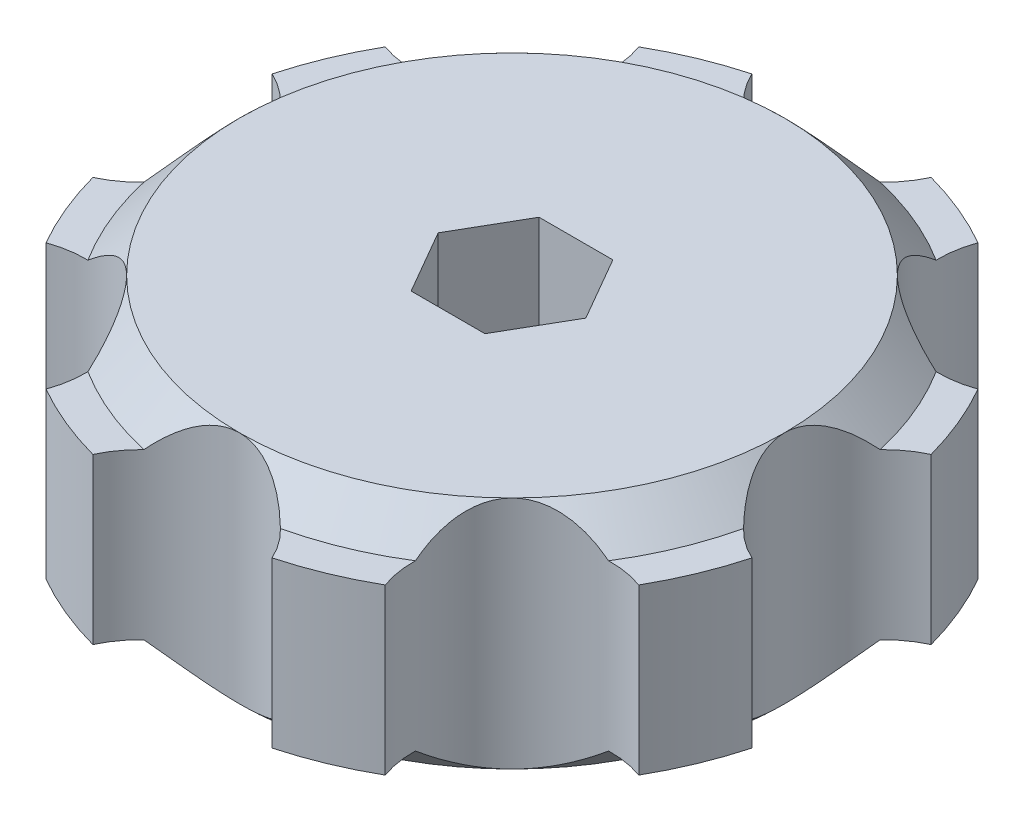
from build123d import *

# Parameters (mm, degrees)
SKETCH1_R           = 15.55551692
BOSS_EXTRUDE1_DEPTH = 9.4
BOSS_EXTRUDE2_START = 9.4
SKETCH1_4_R         = 15.55551692
BOSS_EXTRUDE2_DEPTH = 2
BOSS_EXTRUDE3_START = -2
SKETCH1_5_R         = 15.55551692
BOSS_EXTRUDE3_DEPTH = 2
CHAMFER2_SIZE       = 2
CUT_EXTRUDE1_DEPTH  = 30.783161882


with BuildPart() as part:
    # Sketch1 → Boss-Extrude1 (new body)
    with BuildSketch(Plane(origin=(0, 0, 0), x_dir=(1, 0, 0), z_dir=(0, 1, 0))):
        with BuildLine():
            ThreePointArc((-16.916819633, -9.681614935), (-13.766406033, -9.47966445), (-10.999411499, -10.999411499))
            ThreePointArc((-10.999411499, -10.999411499), (-14.371423694, -5.952838621), (-15.55551692, -3.1e-08))
            ThreePointArc((-15.55551692, -3.1e-08), (-16.437454083, -3.031184056), (-18.807933452, -5.116062305))
            ThreePointArc((-18.807933452, -5.116062305), (-18.007652913, -7.459014063), (-16.916819633, -9.681614935))
        make_face()
        with BuildLine():
            ThreePointArc((-5.116062305, -18.807933452), (-3.031184038, -16.437454071), (1.1e-08, -15.55551692))
            ThreePointArc((1.1e-08, -15.55551692), (-5.952838602, -14.371423702), (-10.999411499, -10.999411499))
            ThreePointArc((-10.999411499, -10.999411499), (-9.47966445, -13.766406033), (-9.681614935, -16.916819633))
            ThreePointArc((-9.681614935, -16.916819633), (-7.459014063, -18.007652913), (-5.116062305, -18.807933452))
        make_face()
        with BuildLine():
            ThreePointArc((1.1e-08, -15.55551692), (3.031184048, -16.437454078), (5.116062305, -18.807933452))
            ThreePointArc((5.116062305, -18.807933452), (7.459014063, -18.007652913), (9.681614935, -16.916819633))
            ThreePointArc((9.681614935, -16.916819633), (9.47966445, -13.766406033), (10.999411499, -10.999411499))
            ThreePointArc((10.999411499, -10.999411499), (5.952838612, -14.371423698), (1.1e-08, -15.55551692))
        make_face()
        Circle(SKETCH1_R)
        with BuildLine():
            ThreePointArc((15.55551692, 0), (14.3714237, -5.952838607), (10.999411499, -10.999411499))
            ThreePointArc((10.999411499, -10.999411499), (13.766406033, -9.47966445), (16.916819633, -9.681614935))
            ThreePointArc((16.916819633, -9.681614935), (18.007652913, -7.459014063), (18.807933452, -5.116062305))
            ThreePointArc((18.807933452, -5.116062305), (16.437454074, -3.031184043), (15.55551692, 0))
        make_face()
        with BuildLine():
            ThreePointArc((10.999411479, 10.999411519), (14.371423695, 5.95283862), (15.55551692, 0))
            ThreePointArc((15.55551692, 0), (16.437454074, 3.031184043), (18.807933452, 5.116062305))
            ThreePointArc((18.807933452, 5.116062305), (18.007652913, 7.459014063), (16.916819633, 9.681614935))
            ThreePointArc((16.916819633, 9.681614935), (13.76640602, 9.479664453), (10.999411479, 10.999411519))
        make_face()
        with BuildLine():
            ThreePointArc((-2e-09, 15.55551692), (5.952838593, 14.371423706), (10.999411479, 10.999411519))
            ThreePointArc((10.999411479, 10.999411519), (9.479664447, 13.766406047), (9.681614935, 16.916819633))
            ThreePointArc((9.681614935, 16.916819633), (7.459014063, 18.007652913), (5.116062305, 18.807933452))
            ThreePointArc((5.116062305, 18.807933452), (3.031184042, 16.437454074), (-2e-09, 15.55551692))
        make_face()
        with BuildLine():
            ThreePointArc((-9.681614935, 16.916819633), (-9.479664448, 13.766406042), (-10.999411487, 10.999411511))
            ThreePointArc((-10.999411487, 10.999411511), (-5.9528386, 14.371423703), (-2e-09, 15.55551692))
            ThreePointArc((-2e-09, 15.55551692), (-3.031184044, 16.437454075), (-5.116062305, 18.807933452))
            ThreePointArc((-5.116062305, 18.807933452), (-7.459014063, 18.007652913), (-9.681614935, 16.916819633))
        make_face()
        with BuildLine():
            ThreePointArc((-18.807933452, 5.116062305), (-16.437454066, 3.03118403), (-15.55551692, -3.1e-08))
            ThreePointArc((-15.55551692, -3.1e-08), (-14.371423703, 5.952838601), (-10.999411487, 10.999411511))
            ThreePointArc((-10.999411487, 10.999411511), (-13.766406025, 9.479664452), (-16.916819633, 9.681614935))
            ThreePointArc((-16.916819633, 9.681614935), (-18.007652913, 7.459014063), (-18.807933452, 5.116062305))
        make_face()
    extrude(amount=BOSS_EXTRUDE1_DEPTH)

    # Sketch1<4> → Boss-Extrude2 (add)
    with BuildSketch(Plane(origin=(0, 0, 0), x_dir=(1, 0, 0), z_dir=(0, 1, 0)).offset(BOSS_EXTRUDE2_START)):
        with Locations(Location((0, 0, 0), (0, 0, 270))):
            Circle(SKETCH1_4_R)
    extrude(amount=BOSS_EXTRUDE2_DEPTH)

    # Sketch1<5> → Boss-Extrude3 (add)
    with BuildSketch(Plane(origin=(0, 0, 0), x_dir=(1, 0, 0), z_dir=(0, 1, 0)).offset(BOSS_EXTRUDE3_START)):
        with Locations(Location((0, 0, 0), (0, 0, 270))):
            Circle(SKETCH1_5_R)
    extrude(amount=BOSS_EXTRUDE3_DEPTH)

    # Chamfer2
    # the kernel refuses this chamfer: 2 mm, written as the material it adds along each edge
    with BuildSketch(Plane(origin=(0, 9.4, 0), x_dir=(-1.0, 0, 2.0490157005346928e-09), z_dir=(-2.0490157005346928e-09, 0, -1.0))) as chamfer2_piece_1_section:
        Polygon((15.55551692, CHAMFER2_SIZE), (15.55551692 + CHAMFER2_SIZE, 0), (15.55551692, 0), align=None)
    chamfer2_piece_1 = revolve(axis=Axis((0, 9.4, 0), (0, 1, 0)), revolution_arc=44.99999982, mode=Mode.PRIVATE)
    chamfer2_piece_1 = chamfer2_piece_1 - Plane(origin=(-21.20551692, 10.103766743, 0), x_dir=(1.0, 0, 5.4411098439037235e-09), z_dir=(0, -1, 0)) * Cylinder(5.65, 71, mode=Mode.PRIVATE)
    chamfer2_piece_1 = chamfer2_piece_1 - Plane(origin=(-14.994564813, 10.103766743, 14.994564813), x_dir=(-0.3402220920568066, 0, -0.9403451111567975), z_dir=(0, -1, 0)) * Cylinder(5.65, 71, mode=Mode.PRIVATE)
    add(chamfer2_piece_1)
    with BuildSketch(Plane(origin=(0, 0, 0), x_dir=(-1.0, 0, 7.725603147000415e-10), z_dir=(-7.725603147000415e-10, 0, -1.0))) as chamfer2_piece_2_section:
        Polygon((15.55551692, -CHAMFER2_SIZE), (15.55551692 + CHAMFER2_SIZE, 0), (15.55551692, 0), align=None)
    chamfer2_piece_2 = revolve(axis=Axis((0, 0, 0), (0, 1, 0)), revolution_arc=44.999999894, mode=Mode.PRIVATE)
    chamfer2_piece_2 = chamfer2_piece_2 - Plane(origin=(-21.20551692, -0.703766743, 0), x_dir=(1.0, 0, 5.4411098439037235e-09), z_dir=(0, -1, 0)) * Cylinder(5.65, 71, mode=Mode.PRIVATE)
    chamfer2_piece_2 = chamfer2_piece_2 - Plane(origin=(-14.994564813, -0.703766743, 14.994564813), x_dir=(-0.3402220920568066, 0, -0.9403451111567975), z_dir=(0, -1, 0)) * Cylinder(5.65, 71, mode=Mode.PRIVATE)
    add(chamfer2_piece_2)
    with BuildSketch(Plane(origin=(0, 0, 0), x_dir=(-0.7071067817031288, 0, -0.7071067806699662), z_dir=(0.7071067806699662, 0, -0.7071067817031288))) as chamfer2_piece_3_section:
        Polygon((15.55551692 + CHAMFER2_SIZE, 0), (15.55551692, -CHAMFER2_SIZE), (15.55551692, 0), align=None)
    chamfer2_piece_3 = revolve(axis=Axis((0, 0, 0), (0, 1, 0)), revolution_arc=45.000000002, mode=Mode.PRIVATE)
    chamfer2_piece_3 = chamfer2_piece_3 - Plane(origin=(-14.994564813, -0.703766886, -14.994564813), x_dir=(0.9403451111567979, 0, -0.34022209205680554), z_dir=(0, -1, 0)) * Cylinder(5.65, 71, mode=Mode.PRIVATE)
    chamfer2_piece_3 = chamfer2_piece_3 - Plane(origin=(-21.20551692, -0.703766886, 0), x_dir=(1.0, 0, 5.4411098439037235e-09), z_dir=(0, -1, 0)) * Cylinder(5.65, 71, mode=Mode.PRIVATE)
    add(chamfer2_piece_3)
    with BuildSketch(Plane(origin=(0, 0, 0), x_dir=(-0.7071067819532592, 0, 0.707106780419836), z_dir=(-0.707106780419836, 0, -0.7071067819532592))) as chamfer2_piece_4_section:
        Polygon((15.55551692, -CHAMFER2_SIZE), (15.55551692 + CHAMFER2_SIZE, 0), (15.55551692, 0), align=None)
    chamfer2_piece_4 = revolve(axis=Axis((0, 0, 0), (0, 1, 0)), revolution_arc=45.000000062, mode=Mode.PRIVATE)
    chamfer2_piece_4 = chamfer2_piece_4 - Plane(origin=(-14.994564813, -0.703766753, 14.994564813), x_dir=(-0.3402220920568066, 0, -0.9403451111567975), z_dir=(0, -1, 0)) * Cylinder(5.65, 71, mode=Mode.PRIVATE)
    chamfer2_piece_4 = chamfer2_piece_4 - Plane(origin=(0, -0.703766753, 21.20551692), x_dir=(-0.9054977531574303, 0, -0.42435105635174936), z_dir=(0, -1, 0)) * Cylinder(5.65, 71, mode=Mode.PRIVATE)
    add(chamfer2_piece_4)
    with BuildSketch(Plane(origin=(0, 0, 0), x_dir=(0, 0, 1), z_dir=(-1, 0, 0))) as chamfer2_piece_5_section:
        Polygon((15.55551692, -CHAMFER2_SIZE), (15.55551692 + CHAMFER2_SIZE, 0), (15.55551692, 0), align=None)
    chamfer2_piece_5 = revolve(axis=Axis((0, 0, 0), (0, 1, 0)), revolution_arc=45, mode=Mode.PRIVATE)
    chamfer2_piece_5 = chamfer2_piece_5 - Plane(origin=(14.994564813, -0.703766753, 14.994564813), x_dir=(-0.9403451111567976, 0, 0.34022209205680604), z_dir=(0, -1, 0)) * Cylinder(5.65, 71, mode=Mode.PRIVATE)
    chamfer2_piece_5 = chamfer2_piece_5 - Plane(origin=(0, -0.703766753, 21.20551692), x_dir=(-0.9054977531574303, 0, -0.42435105635174936), z_dir=(0, -1, 0)) * Cylinder(5.65, 71, mode=Mode.PRIVATE)
    add(chamfer2_piece_5)
    with BuildSketch(Plane(origin=(0, 0, 0), x_dir=(0.7071067811865478, 0, 0.7071067811865472), z_dir=(-0.7071067811865472, 0, 0.7071067811865478))) as chamfer2_piece_6_section:
        Polygon((15.55551692, -CHAMFER2_SIZE), (15.55551692 + CHAMFER2_SIZE, 0), (15.55551692, 0), align=None)
    chamfer2_piece_6 = revolve(axis=Axis((0, 0, 0), (0, 1, 0)), revolution_arc=44.999999983, mode=Mode.PRIVATE)
    chamfer2_piece_6 = chamfer2_piece_6 - Plane(origin=(14.994564813, -0.703766753, 14.994564813), x_dir=(-0.9403451111567976, 0, 0.34022209205680604), z_dir=(0, -1, 0)) * Cylinder(5.65, 71, mode=Mode.PRIVATE)
    chamfer2_piece_6 = chamfer2_piece_6 - Plane(origin=(21.20551692, -0.703766753, 0), x_dir=(-0.42435105635174664, 0, 0.9054977531574315), z_dir=(0, -1, 0)) * Cylinder(5.65, 71, mode=Mode.PRIVATE)
    add(chamfer2_piece_6)
    with BuildSketch(Plane(origin=(0, 0, 0), x_dir=(1.0, 0, 2.989517751270151e-10), z_dir=(-2.989517751270151e-10, 0, 1.0))) as chamfer2_piece_7_section:
        Polygon((15.55551692, -CHAMFER2_SIZE), (15.55551692 + CHAMFER2_SIZE, 0), (15.55551692, 0), align=None)
    chamfer2_piece_7 = revolve(axis=Axis((0, 0, 0), (0, 1, 0)), revolution_arc=45.000000088, mode=Mode.PRIVATE)
    chamfer2_piece_7 = chamfer2_piece_7 - Plane(origin=(14.994564813, -0.703766753, -14.994564813), x_dir=(0.3402220920568063, 0, 0.9403451111567976), z_dir=(0, -1, 0)) * Cylinder(5.65, 71, mode=Mode.PRIVATE)
    chamfer2_piece_7 = chamfer2_piece_7 - Plane(origin=(21.20551692, -0.703766753, 0), x_dir=(-0.42435105635174664, 0, 0.9054977531574315), z_dir=(0, -1, 0)) * Cylinder(5.65, 71, mode=Mode.PRIVATE)
    add(chamfer2_piece_7)
    with BuildSketch(Plane(origin=(0, 0, 0), x_dir=(0.7071067803065033, 0, -0.7071067820665917), z_dir=(0.7071067820665917, 0, 0.7071067803065033))) as chamfer2_piece_8_section:
        Polygon((15.55551692, -CHAMFER2_SIZE), (15.55551692 + CHAMFER2_SIZE, 0), (15.55551692, 0), align=None)
    chamfer2_piece_8 = revolve(axis=Axis((0, 0, 0), (0, 1, 0)), revolution_arc=44.999999963, mode=Mode.PRIVATE)
    chamfer2_piece_8 = chamfer2_piece_8 - Plane(origin=(0, -0.703766753, -21.20551692), x_dir=(0.9054977531574306, 0, 0.4243510563517486), z_dir=(0, -1, 0)) * Cylinder(5.65, 71, mode=Mode.PRIVATE)
    chamfer2_piece_8 = chamfer2_piece_8 - Plane(origin=(14.994564813, -0.703766753, -14.994564813), x_dir=(0.3402220920568063, 0, 0.9403451111567976), z_dir=(0, -1, 0)) * Cylinder(5.65, 71, mode=Mode.PRIVATE)
    add(chamfer2_piece_8)
    with BuildSketch(Plane(origin=(0, 0, 0), x_dir=(-5.915567194248534e-10, 0, -1.0), z_dir=(1.0, 0, -5.915567194248534e-10))) as chamfer2_piece_9_section:
        Polygon((15.55551692 + CHAMFER2_SIZE, 0), (15.55551692, -CHAMFER2_SIZE), (15.55551692, 0), align=None)
    chamfer2_piece_9 = revolve(axis=Axis((0, 0, 0), (0, 1, 0)), revolution_arc=45.000000008, mode=Mode.PRIVATE)
    chamfer2_piece_9 = chamfer2_piece_9 - Plane(origin=(-14.994564813, -0.703766753, -14.994564813), x_dir=(0.9403451111567979, 0, -0.34022209205680554), z_dir=(0, -1, 0)) * Cylinder(5.65, 71, mode=Mode.PRIVATE)
    chamfer2_piece_9 = chamfer2_piece_9 - Plane(origin=(0, -0.703766753, -21.20551692), x_dir=(0.9054977531574306, 0, 0.4243510563517486), z_dir=(0, -1, 0)) * Cylinder(5.65, 71, mode=Mode.PRIVATE)
    add(chamfer2_piece_9)
    with BuildSketch(Plane(origin=(0, 9.4, 0), x_dir=(-0.7071067817625238, 0, -0.7071067806105713), z_dir=(0.7071067806105713, 0, -0.7071067817625238))) as chamfer2_piece_10_section:
        Polygon((15.55551692 + CHAMFER2_SIZE, 0), (15.55551692, CHAMFER2_SIZE), (15.55551692, 0), align=None)
    chamfer2_piece_10 = revolve(axis=Axis((0, 9.4, 0), (0, 1, 0)), revolution_arc=45.000000071, mode=Mode.PRIVATE)
    chamfer2_piece_10 = chamfer2_piece_10 - Plane(origin=(-14.994564813, 10.103766886, -14.994564813), x_dir=(0.9403451111567979, 0, -0.34022209205680554), z_dir=(0, -1, 0)) * Cylinder(5.65, 71, mode=Mode.PRIVATE)
    chamfer2_piece_10 = chamfer2_piece_10 - Plane(origin=(-21.20551692, 10.103766886, 0), x_dir=(1.0, 0, 5.4411098439037235e-09), z_dir=(0, -1, 0)) * Cylinder(5.65, 71, mode=Mode.PRIVATE)
    add(chamfer2_piece_10)
    with BuildSketch(Plane(origin=(0, 9.4, 0), x_dir=(-0.7071067819532597, 0, 0.7071067804198353), z_dir=(-0.7071067804198353, 0, -0.7071067819532597))) as chamfer2_piece_11_section:
        Polygon((15.55551692, CHAMFER2_SIZE), (15.55551692 + CHAMFER2_SIZE, 0), (15.55551692, 0), align=None)
    chamfer2_piece_11 = revolve(axis=Axis((0, 9.4, 0), (0, 1, 0)), revolution_arc=45.000000062, mode=Mode.PRIVATE)
    chamfer2_piece_11 = chamfer2_piece_11 - Plane(origin=(-14.994564813, 10.103766753, 14.994564813), x_dir=(-0.3402220920568066, 0, -0.9403451111567975), z_dir=(0, -1, 0)) * Cylinder(5.65, 71, mode=Mode.PRIVATE)
    chamfer2_piece_11 = chamfer2_piece_11 - Plane(origin=(0, 10.103766753, 21.20551692), x_dir=(-0.9054977531574303, 0, -0.42435105635174936), z_dir=(0, -1, 0)) * Cylinder(5.65, 71, mode=Mode.PRIVATE)
    add(chamfer2_piece_11)
    with BuildSketch(Plane(origin=(0, 9.4, 0), x_dir=(0, 0, 1), z_dir=(-1, 0, 0))) as chamfer2_piece_12_section:
        Polygon((15.55551692, CHAMFER2_SIZE), (15.55551692 + CHAMFER2_SIZE, 0), (15.55551692, 0), align=None)
    chamfer2_piece_12 = revolve(axis=Axis((0, 9.4, 0), (0, 1, 0)), revolution_arc=44.999999899, mode=Mode.PRIVATE)
    chamfer2_piece_12 = chamfer2_piece_12 - Plane(origin=(14.994564813, 10.103766753, 14.994564813), x_dir=(-0.9403451111567976, 0, 0.34022209205680604), z_dir=(0, -1, 0)) * Cylinder(5.65, 71, mode=Mode.PRIVATE)
    chamfer2_piece_12 = chamfer2_piece_12 - Plane(origin=(0, 10.103766753, 21.20551692), x_dir=(-0.9054977531574303, 0, -0.42435105635174936), z_dir=(0, -1, 0)) * Cylinder(5.65, 71, mode=Mode.PRIVATE)
    add(chamfer2_piece_12)
    with BuildSketch(Plane(origin=(0, 9.4, 0), x_dir=(0.7071067799459831, 0, 0.7071067824271119), z_dir=(-0.7071067824271119, 0, 0.7071067799459831))) as chamfer2_piece_13_section:
        Polygon((15.55551692, CHAMFER2_SIZE), (15.55551692 + CHAMFER2_SIZE, 0), (15.55551692, 0), align=None)
    chamfer2_piece_13 = revolve(axis=Axis((0, 9.4, 0), (0, 1, 0)), revolution_arc=45.000000076, mode=Mode.PRIVATE)
    chamfer2_piece_13 = chamfer2_piece_13 - Plane(origin=(14.994564813, 10.103766753, 14.994564813), x_dir=(-0.9403451111567976, 0, 0.34022209205680604), z_dir=(0, -1, 0)) * Cylinder(5.65, 71, mode=Mode.PRIVATE)
    chamfer2_piece_13 = chamfer2_piece_13 - Plane(origin=(21.20551692, 10.103766753, 0), x_dir=(-0.42435105635174664, 0, 0.9054977531574315), z_dir=(0, -1, 0)) * Cylinder(5.65, 71, mode=Mode.PRIVATE)
    add(chamfer2_piece_13)
    with BuildSketch(Plane(origin=(0, 9.4, 0), x_dir=(1.0, 0, 4.268254867465012e-10), z_dir=(-4.268254867465012e-10, 0, 1.0))) as chamfer2_piece_14_section:
        Polygon((15.55551692, CHAMFER2_SIZE), (15.55551692 + CHAMFER2_SIZE, 0), (15.55551692, 0), align=None)
    chamfer2_piece_14 = revolve(axis=Axis((0, 9.4, 0), (0, 1, 0)), revolution_arc=44.999999936, mode=Mode.PRIVATE)
    chamfer2_piece_14 = chamfer2_piece_14 - Plane(origin=(14.994564813, 10.103766753, -14.994564813), x_dir=(0.3402220920568063, 0, 0.9403451111567976), z_dir=(0, -1, 0)) * Cylinder(5.65, 71, mode=Mode.PRIVATE)
    chamfer2_piece_14 = chamfer2_piece_14 - Plane(origin=(21.20551692, 10.103766753, 0), x_dir=(-0.42435105635174664, 0, 0.9054977531574315), z_dir=(0, -1, 0)) * Cylinder(5.65, 71, mode=Mode.PRIVATE)
    add(chamfer2_piece_14)
    with BuildSketch(Plane(origin=(0, 9.4, 0), x_dir=(0.7071067822725222, 0, -0.7071067801005728), z_dir=(0.7071067801005728, 0, 0.7071067822725222))) as chamfer2_piece_15_section:
        Polygon((15.55551692, CHAMFER2_SIZE), (15.55551692 + CHAMFER2_SIZE, 0), (15.55551692, 0), align=None)
    chamfer2_piece_15 = revolve(axis=Axis((0, 9.4, 0), (0, 1, 0)), revolution_arc=45.000000081, mode=Mode.PRIVATE)
    chamfer2_piece_15 = chamfer2_piece_15 - Plane(origin=(0, 10.103766753, -21.20551692), x_dir=(0.9054977531574306, 0, 0.4243510563517486), z_dir=(0, -1, 0)) * Cylinder(5.65, 71, mode=Mode.PRIVATE)
    chamfer2_piece_15 = chamfer2_piece_15 - Plane(origin=(14.994564813, 10.103766753, -14.994564813), x_dir=(0.3402220920568063, 0, 0.9403451111567976), z_dir=(0, -1, 0)) * Cylinder(5.65, 71, mode=Mode.PRIVATE)
    add(chamfer2_piece_15)
    with BuildSketch(Plane(origin=(0, 9.4, 0), x_dir=(1.1417875063861984e-10, 0, -1.0), z_dir=(1.0, 0, 1.1417875063861984e-10))) as chamfer2_piece_16_section:
        Polygon((15.55551692 + CHAMFER2_SIZE, 0), (15.55551692, CHAMFER2_SIZE), (15.55551692, 0), align=None)
    chamfer2_piece_16 = revolve(axis=Axis((0, 9.4, 0), (0, 1, 0)), revolution_arc=45.000000053, mode=Mode.PRIVATE)
    chamfer2_piece_16 = chamfer2_piece_16 - Plane(origin=(-14.994564813, 10.103766753, -14.994564813), x_dir=(0.9403451111567979, 0, -0.34022209205680554), z_dir=(0, -1, 0)) * Cylinder(5.65, 71, mode=Mode.PRIVATE)
    chamfer2_piece_16 = chamfer2_piece_16 - Plane(origin=(0, 10.103766753, -21.20551692), x_dir=(0.9054977531574306, 0, 0.4243510563517486), z_dir=(0, -1, 0)) * Cylinder(5.65, 71, mode=Mode.PRIVATE)
    add(chamfer2_piece_16)

    # Sketch2 → Cut-Extrude1 (cut, through all)
    with BuildSketch(Plane(origin=(0, 11.4, 0), x_dir=(1, 0, 0), z_dir=(0, 1, 0))):
        Polygon((-2.107328483, -3.65), (2.107328483, -3.65), (4.214656965, 0), (2.107328483, 3.65), (-2.107328483, 3.65), (-4.214656965, 0), align=None)
    extrude(amount=-CUT_EXTRUDE1_DEPTH, mode=Mode.SUBTRACT)


solid = part.part
